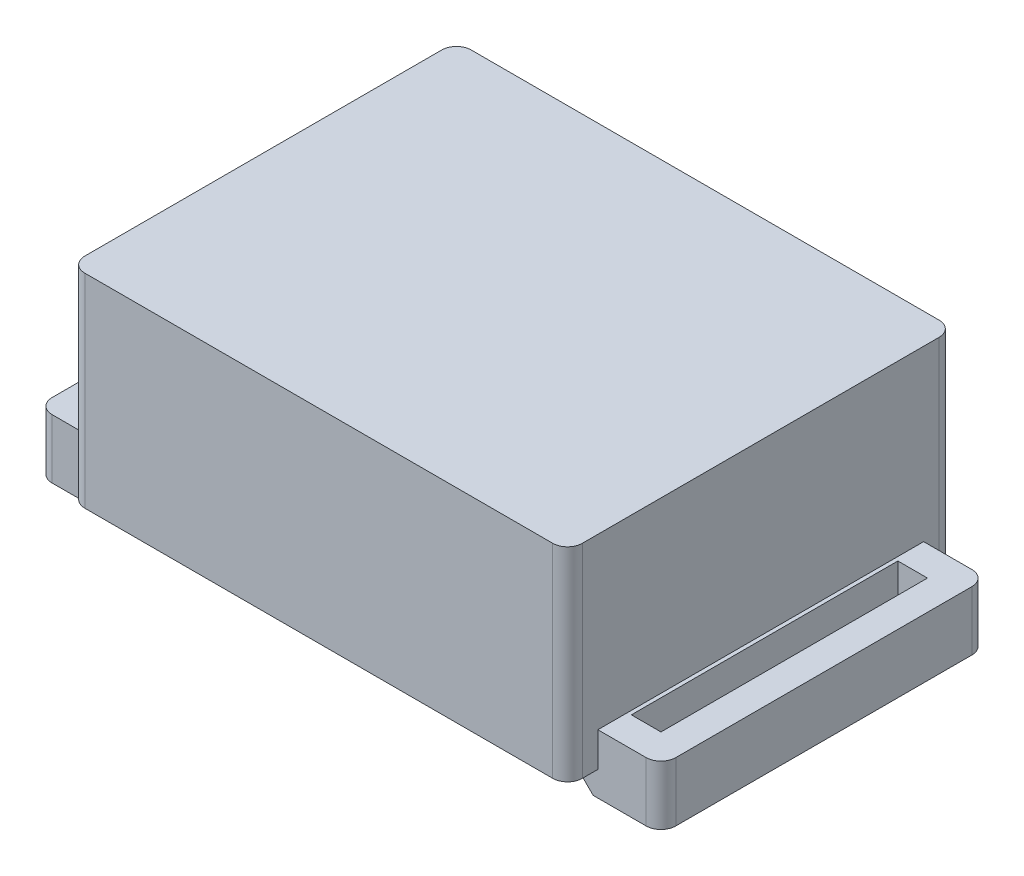
from build123d import *

# Parameters (mm, degrees)
SKETCH1_W                = 33.6
SKETCH1_H                = 26.1
BOSS_EXTRUDE1_DEPTH      = 13.75
BOSS_EXTRUDE2_DEPTH      = 2.32
BOSS_EXTRUDE2_DEPTH_BACK = 1.68
SKETCH2_W                = 4.26
SKETCH2_H                = 22
SKETCH3_W                = 2
SKETCH3_H                = 18
CUT_EXTRUDE1_DEPTH       = 28.284995877
CHAMFER1_SIZE            = 2
FILLET1_R                = 1


with BuildPart() as part:
    # Sketch1 → Boss-Extrude1 (new body)
    with BuildSketch(Plane(origin=(0, 0, 0), x_dir=(1, 0, 0), z_dir=(0, 1, 0))):
        Rectangle(SKETCH1_W, SKETCH1_H)
    extrude(amount=BOSS_EXTRUDE1_DEPTH)

    # Sketch2 → Boss-Extrude2 (add, two sides: drawn at the far end of the back side and taken through both)
    with BuildSketch(Plane(origin=(0, 0, 0), x_dir=(1, 0, 0), z_dir=(0, 1, 0)).offset(-BOSS_EXTRUDE2_DEPTH_BACK)):
        with Locations((18.93, 0)):
            Rectangle(SKETCH2_W, SKETCH2_H)
        with Locations((-18.93, 0)):
            Rectangle(SKETCH2_W, SKETCH2_H)
    extrude(amount=BOSS_EXTRUDE2_DEPTH + BOSS_EXTRUDE2_DEPTH_BACK)

    # Sketch3 → Cut-Extrude1 (cut, through all)
    with BuildSketch(Plane(origin=(0, 2.32, 0), x_dir=(1, 0, 0), z_dir=(0, 1, 0))):
        with Locations((18.06, 0)):
            Rectangle(SKETCH3_W, SKETCH3_H)
        with Locations((-18.06, 0)):
            Rectangle(SKETCH3_W, SKETCH3_H)
    extrude(amount=-CUT_EXTRUDE1_DEPTH, mode=Mode.SUBTRACT)

    # Chamfer1
    # the kernel refuses this chamfer: 2 mm, written as the material it adds along each edge
    with BuildSketch(Plane(origin=(16.8, 0, -11), x_dir=(-0.9996219169112968, 0.027495876610586365, 0), z_dir=(0, 0, 1))) as chamfer1_piece_1_section:
        Polygon((CHAMFER1_SIZE * 0.999621916911, CHAMFER1_SIZE * 0.0274958766106), (-CHAMFER1_SIZE * 0.0274958766106, CHAMFER1_SIZE * 0.999621916911), (0, 0), align=None)
    chamfer1_piece_1 = extrude(amount=22, mode=Mode.PRIVATE)
    chamfer1_piece_1 = split(chamfer1_piece_1, bisect_by=Plane(origin=(16.11862069, -1.68, 0), z_dir=(0, 1, 0)), keep=Keep.TOP, mode=Mode.PRIVATE)
    add(chamfer1_piece_1)
    with BuildSketch(Plane(origin=(-16.8, 0, 11), x_dir=(0.9996219169112968, 0.027495876610586365, 0), z_dir=(0, 0, -1))) as chamfer1_piece_2_section:
        Polygon((CHAMFER1_SIZE * 0.999621916911, CHAMFER1_SIZE * 0.0274958766106), (-CHAMFER1_SIZE * 0.0274958766106, CHAMFER1_SIZE * 0.999621916911), (0, 0), align=None)
    chamfer1_piece_2 = extrude(amount=22, mode=Mode.PRIVATE)
    chamfer1_piece_2 = split(chamfer1_piece_2, bisect_by=Plane(origin=(-16.11862069, -1.68, 0), z_dir=(0, 1, 0)), keep=Keep.TOP, mode=Mode.PRIVATE)
    add(chamfer1_piece_2)

    # Fillet1
    fillet1_edges = [part.edges().sort_by_distance(p)[0] for p in [
        (21.06, 0.32, 11),
        (21.06, 0.32, -11),
        (-21.06, 0.32, -11),
        (-21.06, 0.32, 11),
        (-16.8, 6.875, -13.05),
        (16.8, 6.875, -13.05),
        (16.8, 6.875, 13.05),
        (-16.8, 6.875, 13.05),
    ]]
    fillet(fillet1_edges, radius=FILLET1_R)


solid = part.part
